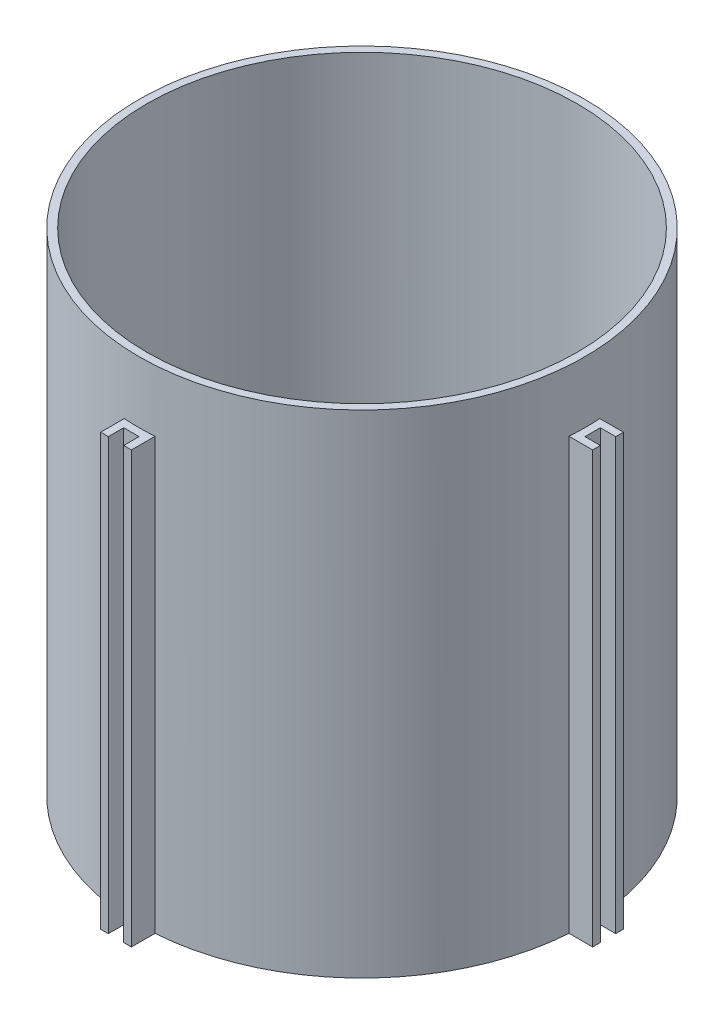
from build123d import *

# Parameters (mm, degrees)
SKETCH1_R         = 92.075
SKETCH1_R_2       = 88.9
BASE_SHELL_DEPTH  = 203.2
SKETCH2_R         = 88.9
SKETCH2_R_2       = 3.175
SKETCH2_R_3       = 3.174999998
SKETCH2_R_4       = 3.174999999
SKETCH2_R_5       = 3.175000001
BOLT_INSERT_DEPTH = 6.35
FIN_BRACKET_DEPTH = 177.8
CIRPATTERN1_COUNT = 4


with BuildPart() as part:
    # Sketch1 → Base Shell (new body)
    with BuildSketch(Plane(origin=(0, 0, 0), x_dir=(1, 0, 0), z_dir=(0, 1, 0))):
        Circle(SKETCH1_R)
        Circle(SKETCH1_R_2, mode=Mode.SUBTRACT)
    extrude(amount=BASE_SHELL_DEPTH)

    # Sketch2 → Bolt Insert (add)
    with BuildSketch(Plane.XZ):
        Circle(SKETCH2_R)
        with Locations((0, 79.375)):
            Circle(SKETCH2_R_2, mode=Mode.SUBTRACT)
        with Locations((79.375000001, -1e-09)):
            Circle(SKETCH2_R_3, mode=Mode.SUBTRACT)
        with Locations((0, -79.375000003)):
            Circle(SKETCH2_R_4, mode=Mode.SUBTRACT)
        with Locations((-79.375000001, -1e-09)):
            Circle(SKETCH2_R_5, mode=Mode.SUBTRACT)
        with BuildLine():
            ThreePointArc((-78.8035, -9.507839542), (-56.126600757, -56.126600757), (-9.507839542, -78.8035))
            ThreePointArc((-9.507839542, -78.8035), (0, -69.85), (9.507839542, -78.8035))
            ThreePointArc((9.507839542, -78.8035), (56.126600757, -56.126600757), (78.8035, -9.507839542))
            ThreePointArc((78.8035, -9.507839542), (69.85, 0), (78.8035, 9.507839542))
            ThreePointArc((78.8035, 9.507839542), (56.126600757, 56.126600757), (9.507839542, 78.8035))
            ThreePointArc((9.507839542, 78.8035), (0, 69.85), (-9.507839542, 78.8035))
            ThreePointArc((-9.507839542, 78.8035), (-56.126600757, 56.126600757), (-78.8035, 9.507839542))
            ThreePointArc((-78.8035, 9.507839542), (-69.85, 0), (-78.8035, -9.507839542))
        make_face(mode=Mode.SUBTRACT)
    extrude(amount=-BOLT_INSERT_DEPTH)

    # Sketch3 → Fin Bracket (add)
    with BuildSketch(Plane(origin=(0, 0, 0), x_dir=(1, 0, 0), z_dir=(0, 1, 0))):
        with BuildLine():
            Line((-3.175, 101.6), (-6.35, 101.6))
            Line((-6.35, 101.6), (-6.35, 91.855773498))
            ThreePointArc((-6.35, 91.855773498), (0, 92.075), (6.35, 91.855773498))
            Line((6.35, 91.855773498), (6.35, 101.6))
            Line((6.35, 101.6), (3.175, 101.6))
            Line((3.175, 101.6), (3.175, 95.25))
            Line((3.175, 95.25), (-3.175, 95.25))
            Line((-3.175, 95.25), (-3.175, 101.6))
        make_face()
    fin_bracket = extrude(amount=FIN_BRACKET_DEPTH)

    # CirPattern1: Fin Bracket ×4 about axis
    cirpattern1_axis = Axis((0, 203.2, 0), (0, -1, 0))
    for i in range(1, CIRPATTERN1_COUNT):
        add(fin_bracket.rotate(cirpattern1_axis, i * 360 / CIRPATTERN1_COUNT))


solid = part.part
